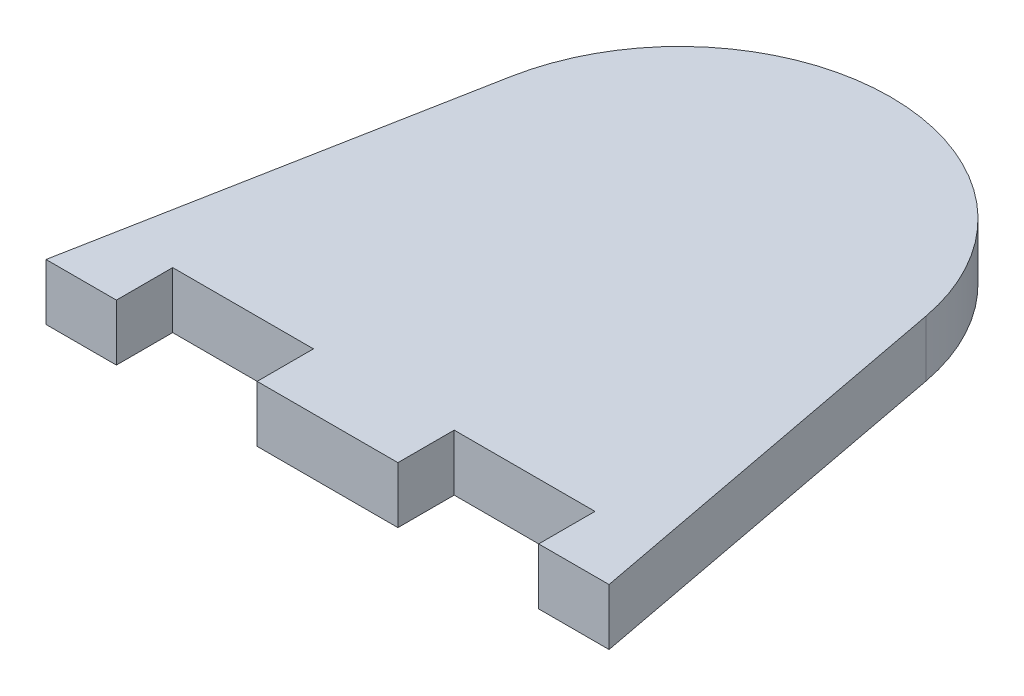
from build123d import *

# Parameters (mm, degrees)
BOSS_EXTRUDE1_DEPTH = 4
BOSS_EXTRUDE2_START = -2
BOSS_EXTRUDE2_DEPTH = 2
SKETCH3_W           = 10
SKETCH3_H           = 4
CUT_EXTRUDE2_DEPTH  = 4


with BuildPart() as part:
    # Sketch1 → Boss-Extrude1 (new body)
    with BuildSketch(Plane(origin=(0, 0, 0), x_dir=(1, 0, 0), z_dir=(0, 1, 0))):
        with BuildLine():
            Line((-14.738148017, 2.790518414), (-20, -25))
            Line((-20, -25), (20, -25))
            Line((20, -25), (14.738148017, 2.790518414))
            ThreePointArc((14.738148017, 2.790518414), (0, 15), (-14.738148017, 2.790518414))
        make_face()
        with BuildLine():
            ThreePointArc((-4.952837091, -0.685131195), (0, 5), (4.952837091, -0.685131195))
            Line((4.952837091, -0.685131195), (3.014993434, -14.693869967))
            Line((3.014993434, -14.693869967), (2.625003658, -17.513119534))
            ThreePointArc((2.625003658, -17.513119534), (0, -19.8), (-2.625003658, -17.513119534))
            Line((-2.625003658, -17.513119534), (-3.014993434, -14.693869967))
            Line((-3.014993434, -14.693869967), (-4.952837091, -0.685131195))
        make_face(mode=Mode.SUBTRACT)
    extrude(amount=BOSS_EXTRUDE1_DEPTH)

    # Sketch2 → Boss-Extrude2 (add)
    with BuildSketch(Plane(origin=(0, 4, 0), x_dir=(1, 0, 0), z_dir=(0, 1, 0)).offset(BOSS_EXTRUDE2_START)):
        with BuildLine():
            Line((-4.952837091, -0.685131195), (-2.625003658, -17.513119534))
            ThreePointArc((-2.625003658, -17.513119534), (0, -19.8), (2.625003658, -17.513119534))
            Line((2.625003658, -17.513119534), (4.952837091, -0.685131195))
            ThreePointArc((4.952837091, -0.685131195), (0, 5), (-4.952837091, -0.685131195))
        make_face()
    extrude(amount=BOSS_EXTRUDE2_DEPTH)

    # Sketch3 → Cut-Extrude2 (cut)
    with BuildSketch(Plane.XZ):
        with Locations((10, 23)):
            Rectangle(SKETCH3_W, SKETCH3_H)
        with Locations((-10, 23)):
            Rectangle(SKETCH3_W, SKETCH3_H)
    extrude(amount=-CUT_EXTRUDE2_DEPTH, mode=Mode.SUBTRACT)


solid = part.part
